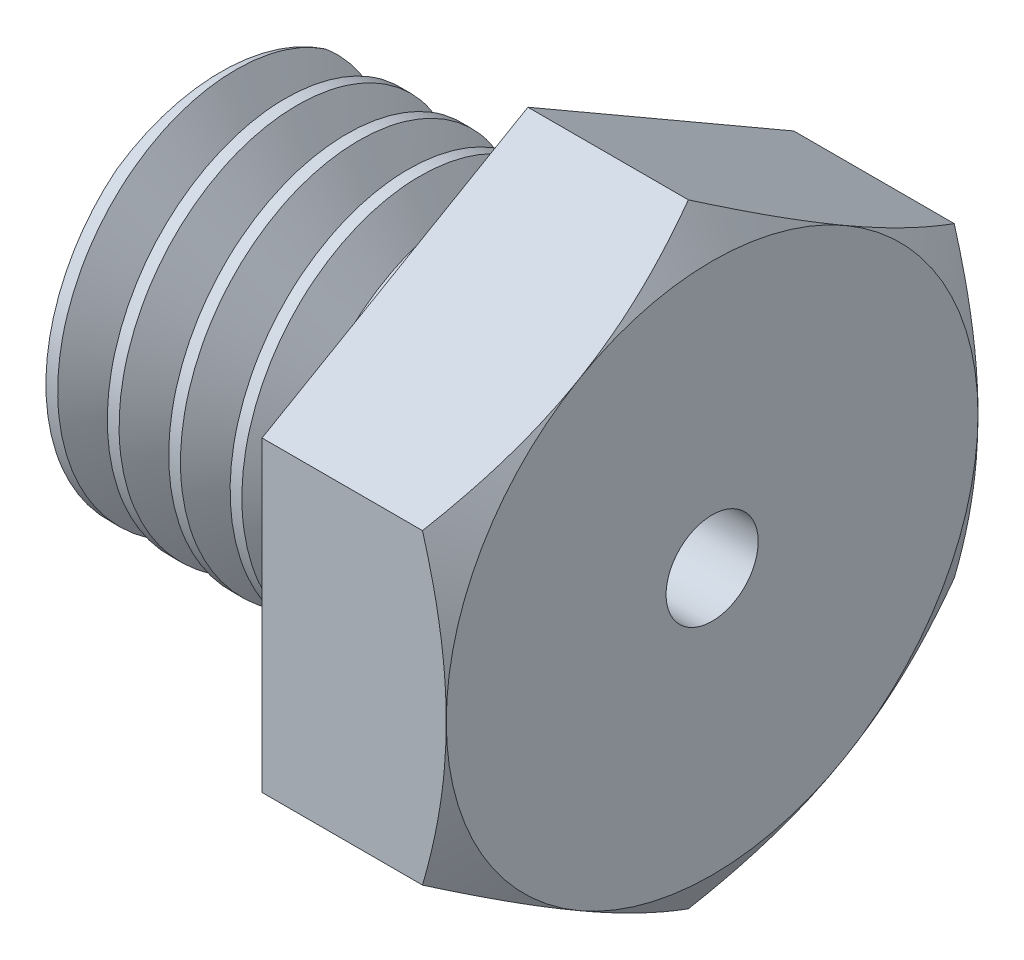
from build123d import *

# Parameters (mm, degrees)
BOSS_EXTRUDE1_DEPTH = 6
SKETCH2_OUTSIDE_W   = 45.53
SKETCH2_OUTSIDE_H   = 48.21
SKETCH2_OUTSIDE_R   = 8.660254038
CUT_EXTRUDE1_DEPTH  = 6
CUT_EXTRUDE1_DRAFT  = -60
SKETCH4_R           = 6
BOSS_EXTRUDE2_DEPTH = 10
CUT_SWEEP1_PITCH    = 2
CUT_SWEEP1_TO       = 10
SKETCH7_R           = 1.5
CUT_EXTRUDE2_DEPTH  = 21.760539659


with BuildPart() as part:
    # Sketch1 → Boss-Extrude1 (new body)
    with BuildSketch(Plane(origin=(0, 0, 0), x_dir=(0, 0, -1), z_dir=(1, 0, 0))):
        Polygon((0, 10), (-8.660254038, 5), (-8.660254038, -5), (0, -10), (8.660254038, -5), (8.660254038, 5), align=None)
    extrude(amount=BOSS_EXTRUDE1_DEPTH)


with BuildPart() as cut_extrude1_tool:
    # Sketch2 outside → Cut-Extrude1 (with draft: the straight prism first)
    with BuildSketch(Plane(origin=(6, 0, 0), x_dir=(0, 0, -1), z_dir=(1, 0, 0))):
        Rectangle(SKETCH2_OUTSIDE_W, SKETCH2_OUTSIDE_H)
        Circle(SKETCH2_OUTSIDE_R, mode=Mode.SUBTRACT)
    extrude(amount=-CUT_EXTRUDE1_DEPTH)
    # Cut-Extrude1: the draft: its side faces are tilted about the plane it starts from
    cut_extrude1_sides = [cut_extrude1_tool.faces().sort_by_distance(p)[0] for p in [
        (3, -24.105, 0),
        (3, 0, -22.765),
        (3, 24.105, 0),
        (3, 0, 22.765),
        (3, 0, 8.660254038),
    ]]
    draft(cut_extrude1_sides, Plane(origin=(6, 0, 0), x_dir=(0, 0, -1), z_dir=(1, 0, 0)), CUT_EXTRUDE1_DRAFT)


with BuildPart() as part_1:
    add(part.part)

    # Cut-Extrude1: cut by cut_extrude1_tool
    add(cut_extrude1_tool.part, mode=Mode.SUBTRACT)

    # Sketch4 → Boss-Extrude2 (add)
    with BuildSketch(Plane.ZY):
        Circle(SKETCH4_R)
    extrude(amount=BOSS_EXTRUDE2_DEPTH)

    # Cut-Sweep1: arcs per turn and ends read off the stored shape
    # Cut-Sweep1: the profile of Sketch6 screwed along a right-hand helix through 7 turns, 10 arcs to a turn; built about Z, then put on its axis
    cut_sweep1_z = Axis((0, 0, 0), (0, 0, 1))
    cut_sweep1_corners = [(4.6, 0, -2), (6.7, 0, -3.212435565), (6.7, 0, -0.787564435)]
    with BuildLine(mode=Mode.PRIVATE) as cut_sweep1_profile:
        Line(cut_sweep1_corners[0], cut_sweep1_corners[1])
        Line(cut_sweep1_corners[1], cut_sweep1_corners[2])
        Line(cut_sweep1_corners[2], cut_sweep1_corners[0])
    cut_sweep1_cap = Face(cut_sweep1_profile.wire())
    cut_sweep1_turn_angles = [0, 18, 36, 54, 72, 90, 108, 126, 144, 162, 180, 198, 216, 234, 252, 270, 288, 306, 324, 342, 360]
    cut_sweep1_turn_weights = [1, 0.9510565162951535, 1, 0.9510565162951535, 1, 0.9510565162951535, 1, 0.9510565162951535, 1, 0.9510565162951535, 1, 0.9510565162951535, 1, 0.9510565162951535, 1, 0.9510565162951535, 1, 0.9510565162951535, 1, 0.9510565162951535, 1]
    cut_sweep1_turn_rails = [Edge.make_bspline([Vector(p[0], p[1], 0).rotate(cut_sweep1_z, cut_sweep1_turn_angles[k]) / cut_sweep1_turn_weights[k] + Vector(0, 0, p[2] + CUT_SWEEP1_PITCH * cut_sweep1_turn_angles[k] / 360) for k in range(21)], [0, 0, 0, 1, 1, 2, 2, 3, 3, 4, 4, 5, 5, 6, 6, 7, 7, 8, 8, 9, 9, 10, 10, 10], 2, cut_sweep1_turn_weights) for p in cut_sweep1_corners]
    cut_sweep1_turn_sides = [Face.make_surface_from_curves(cut_sweep1_turn_rails[p[0]], cut_sweep1_turn_rails[p[1]]) for p in [(0, 1), (1, 2), (2, 0)]]
    cut_sweep1_turn = Solid(Shell([*cut_sweep1_turn_sides, cut_sweep1_cap, cut_sweep1_cap.rotate(cut_sweep1_z, 360).moved(Location((0, 0, CUT_SWEEP1_PITCH * 360 / 360)))]))
    cut_sweep1_each = [*[cut_sweep1_turn.moved(Location((0, 0, CUT_SWEEP1_PITCH * i))) for i in range(7)]]
    add(Plane(origin=(-10, 0, 0), x_dir=(0, -1, 0), z_dir=(1, 0, 0)) * split(Compound([cut_sweep1_each[i] for i in range(0, 7, 2)]), bisect_by=Plane.XY.offset(CUT_SWEEP1_TO), keep=Keep.BOTTOM, mode=Mode.PRIVATE), mode=Mode.SUBTRACT)
    add(Plane(origin=(-10, 0, 0), x_dir=(0, -1, 0), z_dir=(1, 0, 0)) * split(Compound([cut_sweep1_each[i] for i in range(1, 7, 2)]), bisect_by=Plane.XY.offset(CUT_SWEEP1_TO), keep=Keep.BOTTOM, mode=Mode.PRIVATE), mode=Mode.SUBTRACT)

    # Sketch7 → Cut-Extrude2 (cut, through all)
    with BuildSketch(Plane(origin=(6, 0, 0), x_dir=(0, 0, -1), z_dir=(1, 0, 0))):
        Circle(SKETCH7_R)
    extrude(amount=-CUT_EXTRUDE2_DEPTH, mode=Mode.SUBTRACT)


solid = part_1.part
